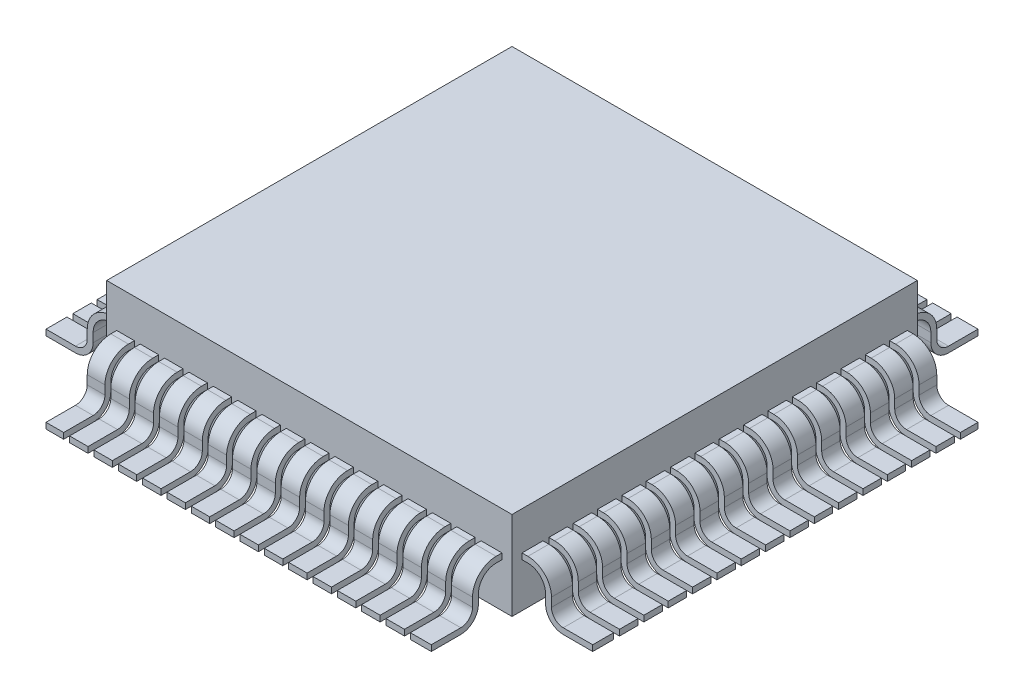
from build123d import *

# Parameters (mm, degrees)
SKETCH_1_W                = 6.88
SKETCH_1_H                = 6.88
EXTRUDE_1_DEPTH           = 1.5
EXTRUDE_1_2_DEPTH         = 6.88
SKETCH_3_W                = 1.2
SKETCH_3_H                = 0.17
CUT_EXTRUDE_1_DEPTH       = 1.5
SKETCH_4_W                = 1.2
SKETCH_4_H                = 0.1
CUT_EXTRUDE_2_DEPTH       = 1.5
PATTERN_LINEAR_1_COUNT    = 15
PATTERN_LINEAR_1_PITCH    = 0.4132
SKETCH_5_R                = 0.131532071
CUT_EXTRUDE_3_DEPTH       = 1
MIRROR_2_COPY_1_SKETCH_W  = 1.2
MIRROR_2_COPY_1_SKETCH_H  = 0.1
MIRROR_2_COPY_1_DEPTH     = 1.5
MIRROR_2_COPY_2_SKETCH_W  = 1.2
MIRROR_2_COPY_2_SKETCH_H  = 0.1
MIRROR_2_COPY_2_DEPTH     = 1.5
MIRROR_2_COPY_3_SKETCH_W  = 1.2
MIRROR_2_COPY_3_SKETCH_H  = 0.1
MIRROR_2_COPY_3_DEPTH     = 1.5
MIRROR_2_COPY_4_SKETCH_W  = 1.2
MIRROR_2_COPY_4_SKETCH_H  = 0.1
MIRROR_2_COPY_4_DEPTH     = 1.5
MIRROR_2_COPY_5_SKETCH_W  = 1.2
MIRROR_2_COPY_5_SKETCH_H  = 0.1
MIRROR_2_COPY_5_DEPTH     = 1.5
MIRROR_2_COPY_6_SKETCH_W  = 1.2
MIRROR_2_COPY_6_SKETCH_H  = 0.1
MIRROR_2_COPY_6_DEPTH     = 1.5
MIRROR_2_COPY_7_SKETCH_W  = 1.2
MIRROR_2_COPY_7_SKETCH_H  = 0.1
MIRROR_2_COPY_7_DEPTH     = 1.5
MIRROR_2_COPY_8_SKETCH_W  = 1.2
MIRROR_2_COPY_8_SKETCH_H  = 0.1
MIRROR_2_COPY_8_DEPTH     = 1.5
MIRROR_2_COPY_9_SKETCH_W  = 1.2
MIRROR_2_COPY_9_SKETCH_H  = 0.1
MIRROR_2_COPY_9_DEPTH     = 1.5
MIRROR_2_COPY_10_SKETCH_W = 1.2
MIRROR_2_COPY_10_SKETCH_H = 0.1
MIRROR_2_COPY_10_DEPTH    = 1.5
MIRROR_2_COPY_11_SKETCH_W = 1.2
MIRROR_2_COPY_11_SKETCH_H = 0.1
MIRROR_2_COPY_11_DEPTH    = 1.5
MIRROR_2_COPY_12_SKETCH_W = 1.2
MIRROR_2_COPY_12_SKETCH_H = 0.1
MIRROR_2_COPY_12_DEPTH    = 1.5
MIRROR_2_COPY_13_SKETCH_W = 1.2
MIRROR_2_COPY_13_SKETCH_H = 0.1
MIRROR_2_COPY_13_DEPTH    = 1.5
MIRROR_2_COPY_14_SKETCH_W = 1.2
MIRROR_2_COPY_14_SKETCH_H = 0.1
MIRROR_2_COPY_14_DEPTH    = 1.5
EXTRUDE_2_DEPTH           = 6.88
CUT_EXTRUDE_4_REACH       = 8.731
SKETCH_7_W                = 0.17
SKETCH_7_H                = 1.2
CUT_EXTRUDE_5_REACH       = 8.731
SKETCH_8_W                = 0.1
SKETCH_8_H                = 1.2
PATTERN_LINEAR_2_COUNT    = 15
PATTERN_LINEAR_2_PITCH    = 0.4132
MIRROR_3_COPY_1_REACH     = 8.731
MIRROR_3_COPY_1_SKETCH_W  = 0.1
MIRROR_3_COPY_1_SKETCH_H  = 1.2
MIRROR_3_COPY_2_REACH     = 8.731
MIRROR_3_COPY_2_SKETCH_W  = 0.1
MIRROR_3_COPY_2_SKETCH_H  = 1.2
MIRROR_3_COPY_3_REACH     = 8.731
MIRROR_3_COPY_3_SKETCH_W  = 0.1
MIRROR_3_COPY_3_SKETCH_H  = 1.2
MIRROR_3_COPY_4_REACH     = 8.731
MIRROR_3_COPY_4_SKETCH_W  = 0.1
MIRROR_3_COPY_4_SKETCH_H  = 1.2
MIRROR_3_COPY_5_REACH     = 8.731
MIRROR_3_COPY_5_SKETCH_W  = 0.1
MIRROR_3_COPY_5_SKETCH_H  = 1.2
MIRROR_3_COPY_6_REACH     = 8.731
MIRROR_3_COPY_6_SKETCH_W  = 0.1
MIRROR_3_COPY_6_SKETCH_H  = 1.2
MIRROR_3_COPY_7_REACH     = 8.731
MIRROR_3_COPY_7_SKETCH_W  = 0.1
MIRROR_3_COPY_7_SKETCH_H  = 1.2
MIRROR_3_COPY_8_REACH     = 8.731
MIRROR_3_COPY_8_SKETCH_W  = 0.1
MIRROR_3_COPY_8_SKETCH_H  = 1.2
MIRROR_3_COPY_9_REACH     = 8.731
MIRROR_3_COPY_9_SKETCH_W  = 0.1
MIRROR_3_COPY_9_SKETCH_H  = 1.2
MIRROR_3_COPY_10_REACH    = 8.731
MIRROR_3_COPY_10_SKETCH_W = 0.1
MIRROR_3_COPY_10_SKETCH_H = 1.2
MIRROR_3_COPY_11_REACH    = 8.731
MIRROR_3_COPY_11_SKETCH_W = 0.1
MIRROR_3_COPY_11_SKETCH_H = 1.2
MIRROR_3_COPY_12_REACH    = 8.731
MIRROR_3_COPY_12_SKETCH_W = 0.1
MIRROR_3_COPY_12_SKETCH_H = 1.2
MIRROR_3_COPY_13_REACH    = 8.731
MIRROR_3_COPY_13_SKETCH_W = 0.1
MIRROR_3_COPY_13_SKETCH_H = 1.2
MIRROR_3_COPY_14_REACH    = 8.731
MIRROR_3_COPY_14_SKETCH_W = 0.1
MIRROR_3_COPY_14_SKETCH_H = 1.2


with BuildPart() as part:
    # 草图1 → Extrude 1 (new body)
    with BuildSketch(Plane(origin=(0, 0, 0), x_dir=(1, 0, 0), z_dir=(0, 1, 0))):
        Rectangle(SKETCH_1_W, SKETCH_1_H)
    extrude(amount=EXTRUDE_1_DEPTH)

    # 草图2 → Extrude 1 2 (add)
    with BuildSketch(Plane.XY.offset(3.44)):
        with BuildLine():
            Line((-3.44, 0.75), (-3.54, 0.75))
            ThreePointArc((-3.54, 0.75), (-3.752132034, 0.662132034), (-3.84, 0.45))
            Line((-3.84, 0.45), (-3.84, 0.3))
            ThreePointArc((-3.84, 0.3), (-3.927867966, 0.087867966), (-4.14, 0))
            Line((-4.14, 0), (-4.64, 0))
            Line((-4.64, 0), (-4.64, 0.1))
            Line((-4.64, 0.1), (-4.14, 0.1))
            ThreePointArc((-4.14, 0.1), (-3.998578644, 0.158578644), (-3.94, 0.3))
            Line((-3.94, 0.3), (-3.94, 0.45))
            ThreePointArc((-3.94, 0.45), (-3.822842712, 0.732842712), (-3.54, 0.85))
            Line((-3.54, 0.85), (-3.44, 0.85))
            Line((-3.44, 0.85), (-3.44, 0.75))
        make_face()
    extrude_1_2 = extrude(amount=-EXTRUDE_1_2_DEPTH)

    # 草图3 → 切除-拉伸1 (cut)
    with BuildSketch(Plane(origin=(0, 1.5, 0), x_dir=(1, 0, 0), z_dir=(0, 1, 0))):
        with Locations((-4.04, 3.355)):
            Rectangle(SKETCH_3_W, SKETCH_3_H)
        with Locations((-4.04, -3.355)):
            Rectangle(SKETCH_3_W, SKETCH_3_H)
    cut_extrude_1 = extrude(amount=-CUT_EXTRUDE_1_DEPTH, mode=Mode.SUBTRACT)

    # 草图4 → 切除-拉伸2 (cut)
    with BuildSketch(Plane(origin=(0, 1.5, 0), x_dir=(1, 0, 0), z_dir=(0, 1, 0))):
        with Locations((-4.04, 2.92)):
            Rectangle(SKETCH_4_W, SKETCH_4_H)
    cut_extrude_2 = extrude(amount=-CUT_EXTRUDE_2_DEPTH, mode=Mode.SUBTRACT)

    # 阵列(线性)1: 切除-拉伸2 ×15
    with Locations(*[(0, 0, i * PATTERN_LINEAR_1_PITCH) for i in range(1, PATTERN_LINEAR_1_COUNT)]):
        add(cut_extrude_2, mode=Mode.SUBTRACT)

    # 草图5 → 切除-拉伸3 (cut)
    with BuildSketch(Plane.XZ):
        with Locations(Location((0, 0, 0), (0, 0, 270))):
            Circle(SKETCH_5_R)
    extrude(amount=-CUT_EXTRUDE_3_DEPTH, mode=Mode.SUBTRACT)

    # 镜向2: Extrude 1 2, 切除-拉伸1, 切除-拉伸2 across plane
    add(extrude_1_2.mirror(Plane(origin=(0, 0, 0), x_dir=(0, 0, 1), z_dir=(1, 0, 0))))
    add(cut_extrude_1.mirror(Plane(origin=(0, 0, 0), x_dir=(0, 0, 1), z_dir=(1, 0, 0))), mode=Mode.SUBTRACT)
    add(cut_extrude_2.mirror(Plane(origin=(0, 0, 0), x_dir=(0, 0, 1), z_dir=(1, 0, 0))), mode=Mode.SUBTRACT)

    # 镜向2 copy 1 sketch → 镜向2 copy 1 (cut)
    with BuildSketch(Plane(origin=(0, 1.5, 0.4132), x_dir=(-1, 0, 0), z_dir=(0, 1, 0))):
        with Locations((-4.04, -2.92)):
            Rectangle(MIRROR_2_COPY_1_SKETCH_W, MIRROR_2_COPY_1_SKETCH_H)
    extrude(amount=-MIRROR_2_COPY_1_DEPTH, mode=Mode.SUBTRACT)

    # 镜向2 copy 2 sketch → 镜向2 copy 2 (cut)
    with BuildSketch(Plane(origin=(0, 1.5, 0.8264), x_dir=(-1, 0, 0), z_dir=(0, 1, 0))):
        with Locations((-4.04, -2.92)):
            Rectangle(MIRROR_2_COPY_2_SKETCH_W, MIRROR_2_COPY_2_SKETCH_H)
    extrude(amount=-MIRROR_2_COPY_2_DEPTH, mode=Mode.SUBTRACT)

    # 镜向2 copy 3 sketch → 镜向2 copy 3 (cut)
    with BuildSketch(Plane(origin=(0, 1.5, 1.2396), x_dir=(-1, 0, 0), z_dir=(0, 1, 0))):
        with Locations((-4.04, -2.92)):
            Rectangle(MIRROR_2_COPY_3_SKETCH_W, MIRROR_2_COPY_3_SKETCH_H)
    extrude(amount=-MIRROR_2_COPY_3_DEPTH, mode=Mode.SUBTRACT)

    # 镜向2 copy 4 sketch → 镜向2 copy 4 (cut)
    with BuildSketch(Plane(origin=(0, 1.5, 1.6528), x_dir=(-1, 0, 0), z_dir=(0, 1, 0))):
        with Locations((-4.04, -2.92)):
            Rectangle(MIRROR_2_COPY_4_SKETCH_W, MIRROR_2_COPY_4_SKETCH_H)
    extrude(amount=-MIRROR_2_COPY_4_DEPTH, mode=Mode.SUBTRACT)

    # 镜向2 copy 5 sketch → 镜向2 copy 5 (cut)
    with BuildSketch(Plane(origin=(0, 1.5, 2.066), x_dir=(-1, 0, 0), z_dir=(0, 1, 0))):
        with Locations((-4.04, -2.92)):
            Rectangle(MIRROR_2_COPY_5_SKETCH_W, MIRROR_2_COPY_5_SKETCH_H)
    extrude(amount=-MIRROR_2_COPY_5_DEPTH, mode=Mode.SUBTRACT)

    # 镜向2 copy 6 sketch → 镜向2 copy 6 (cut)
    with BuildSketch(Plane(origin=(0, 1.5, 2.4792), x_dir=(-1, 0, 0), z_dir=(0, 1, 0))):
        with Locations((-4.04, -2.92)):
            Rectangle(MIRROR_2_COPY_6_SKETCH_W, MIRROR_2_COPY_6_SKETCH_H)
    extrude(amount=-MIRROR_2_COPY_6_DEPTH, mode=Mode.SUBTRACT)

    # 镜向2 copy 7 sketch → 镜向2 copy 7 (cut)
    with BuildSketch(Plane(origin=(0, 1.5, 2.8924), x_dir=(-1, 0, 0), z_dir=(0, 1, 0))):
        with Locations((-4.04, -2.92)):
            Rectangle(MIRROR_2_COPY_7_SKETCH_W, MIRROR_2_COPY_7_SKETCH_H)
    extrude(amount=-MIRROR_2_COPY_7_DEPTH, mode=Mode.SUBTRACT)

    # 镜向2 copy 8 sketch → 镜向2 copy 8 (cut)
    with BuildSketch(Plane(origin=(0, 1.5, 3.3056), x_dir=(-1, 0, 0), z_dir=(0, 1, 0))):
        with Locations((-4.04, -2.92)):
            Rectangle(MIRROR_2_COPY_8_SKETCH_W, MIRROR_2_COPY_8_SKETCH_H)
    extrude(amount=-MIRROR_2_COPY_8_DEPTH, mode=Mode.SUBTRACT)

    # 镜向2 copy 9 sketch → 镜向2 copy 9 (cut)
    with BuildSketch(Plane(origin=(0, 1.5, 3.7188), x_dir=(-1, 0, 0), z_dir=(0, 1, 0))):
        with Locations((-4.04, -2.92)):
            Rectangle(MIRROR_2_COPY_9_SKETCH_W, MIRROR_2_COPY_9_SKETCH_H)
    extrude(amount=-MIRROR_2_COPY_9_DEPTH, mode=Mode.SUBTRACT)

    # 镜向2 copy 10 sketch → 镜向2 copy 10 (cut)
    with BuildSketch(Plane(origin=(0, 1.5, 4.132), x_dir=(-1, 0, 0), z_dir=(0, 1, 0))):
        with Locations((-4.04, -2.92)):
            Rectangle(MIRROR_2_COPY_10_SKETCH_W, MIRROR_2_COPY_10_SKETCH_H)
    extrude(amount=-MIRROR_2_COPY_10_DEPTH, mode=Mode.SUBTRACT)

    # 镜向2 copy 11 sketch → 镜向2 copy 11 (cut)
    with BuildSketch(Plane(origin=(0, 1.5, 4.5452), x_dir=(-1, 0, 0), z_dir=(0, 1, 0))):
        with Locations((-4.04, -2.92)):
            Rectangle(MIRROR_2_COPY_11_SKETCH_W, MIRROR_2_COPY_11_SKETCH_H)
    extrude(amount=-MIRROR_2_COPY_11_DEPTH, mode=Mode.SUBTRACT)

    # 镜向2 copy 12 sketch → 镜向2 copy 12 (cut)
    with BuildSketch(Plane(origin=(0, 1.5, 4.9584), x_dir=(-1, 0, 0), z_dir=(0, 1, 0))):
        with Locations((-4.04, -2.92)):
            Rectangle(MIRROR_2_COPY_12_SKETCH_W, MIRROR_2_COPY_12_SKETCH_H)
    extrude(amount=-MIRROR_2_COPY_12_DEPTH, mode=Mode.SUBTRACT)

    # 镜向2 copy 13 sketch → 镜向2 copy 13 (cut)
    with BuildSketch(Plane(origin=(0, 1.5, 5.3716), x_dir=(-1, 0, 0), z_dir=(0, 1, 0))):
        with Locations((-4.04, -2.92)):
            Rectangle(MIRROR_2_COPY_13_SKETCH_W, MIRROR_2_COPY_13_SKETCH_H)
    extrude(amount=-MIRROR_2_COPY_13_DEPTH, mode=Mode.SUBTRACT)

    # 镜向2 copy 14 sketch → 镜向2 copy 14 (cut)
    with BuildSketch(Plane(origin=(0, 1.5, 5.7848), x_dir=(-1, 0, 0), z_dir=(0, 1, 0))):
        with Locations((-4.04, -2.92)):
            Rectangle(MIRROR_2_COPY_14_SKETCH_W, MIRROR_2_COPY_14_SKETCH_H)
    extrude(amount=-MIRROR_2_COPY_14_DEPTH, mode=Mode.SUBTRACT)

    # 草图6 → 拉伸-薄壁2 (add)
    with BuildSketch(Plane.ZY.offset(3.44)):
        with BuildLine():
            Line((-3.44, 0.75), (-3.54, 0.75))
            ThreePointArc((-3.54, 0.75), (-3.752132034, 0.662132034), (-3.84, 0.45))
            Line((-3.84, 0.45), (-3.84, 0.3))
            ThreePointArc((-3.84, 0.3), (-3.927867966, 0.087867966), (-4.14, 0))
            Line((-4.14, 0), (-4.64, 0))
            Line((-4.64, 0), (-4.64, 0.1))
            Line((-4.64, 0.1), (-4.14, 0.1))
            ThreePointArc((-4.14, 0.1), (-3.998578644, 0.158578644), (-3.94, 0.3))
            Line((-3.94, 0.3), (-3.94, 0.45))
            ThreePointArc((-3.94, 0.45), (-3.822842712, 0.732842712), (-3.54, 0.85))
            Line((-3.54, 0.85), (-3.44, 0.85))
            Line((-3.44, 0.85), (-3.44, 0.75))
        make_face()
    extrude_2 = extrude(amount=-EXTRUDE_2_DEPTH)

    # 草图7 → 切除-拉伸4 (cut, up to next)
    with BuildSketch(Plane(origin=(0, 1.5, 0), x_dir=(1, 0, 0), z_dir=(0, 1, 0)), mode=Mode.PRIVATE) as cut_extrude_4_sk1:
        with Locations((-3.355, 4.04)):
            Rectangle(SKETCH_7_W, SKETCH_7_H)
    cut_extrude_4_tool1 = extrude(cut_extrude_4_sk1.sketch, amount=-CUT_EXTRUDE_4_REACH, mode=Mode.PRIVATE) & part.part
    # 草图7 → 切除-拉伸4 (cut, up to next)
    with BuildSketch(Plane(origin=(0, 1.5, 0), x_dir=(1, 0, 0), z_dir=(0, 1, 0)), mode=Mode.PRIVATE) as cut_extrude_4_sk2:
        with Locations((3.355, 4.04)):
            Rectangle(SKETCH_7_W, SKETCH_7_H)
    cut_extrude_4_tool2 = extrude(cut_extrude_4_sk2.sketch, amount=-CUT_EXTRUDE_4_REACH, mode=Mode.PRIVATE) & part.part
    cut_extrude_4_1 = cut_extrude_4_tool1.solids().sort_by_distance((-3.355, 1.5, -4.04))[0]
    add(cut_extrude_4_1, mode=Mode.SUBTRACT)
    cut_extrude_4_2 = cut_extrude_4_tool2.solids().sort_by_distance((3.355, 1.5, -4.04))[0]
    add(cut_extrude_4_2, mode=Mode.SUBTRACT)
    cut_extrude_4 = cut_extrude_4_1 + cut_extrude_4_2  # 切除-拉伸4 as one shape, for the pattern or mirror that repeats it

    # 草图8 → 切除-拉伸5 (cut, up to next)
    with BuildSketch(Plane(origin=(0, 1.5, 0), x_dir=(1, 0, 0), z_dir=(0, 1, 0)), mode=Mode.PRIVATE) as cut_extrude_5_sk1:
        with Locations((-2.92, 4.04)):
            Rectangle(SKETCH_8_W, SKETCH_8_H)
    cut_extrude_5_tool1 = extrude(cut_extrude_5_sk1.sketch, amount=-CUT_EXTRUDE_5_REACH, mode=Mode.PRIVATE) & part.part
    cut_extrude_5 = cut_extrude_5_tool1.solids().sort_by_distance((-2.92, 1.5, -4.04))[0]
    add(cut_extrude_5, mode=Mode.SUBTRACT)

    # 阵列(线性)2: 切除-拉伸5 ×15
    with Locations(*[(i * PATTERN_LINEAR_2_PITCH, 0, 0) for i in range(1, PATTERN_LINEAR_2_COUNT)]):
        add(cut_extrude_5, mode=Mode.SUBTRACT)

    # 镜向3: 拉伸-薄壁2, 切除-拉伸4, 切除-拉伸5 across plane
    add(extrude_2.mirror(Plane.XY))
    add(cut_extrude_4.mirror(Plane.XY), mode=Mode.SUBTRACT)
    add(cut_extrude_5.mirror(Plane.XY), mode=Mode.SUBTRACT)

    # 镜向3 copy 1 sketch → 镜向3 copy 1 (cut, up to next)
    with BuildSketch(Plane(origin=(0.4132, 1.5, 0), x_dir=(1, 0, 0), z_dir=(0, 1, 0)), mode=Mode.PRIVATE) as mirror_3_copy_1_sk1:
        with Locations((-2.92, -4.04)):
            Rectangle(MIRROR_3_COPY_1_SKETCH_W, MIRROR_3_COPY_1_SKETCH_H)
    mirror_3_copy_1_tool1 = extrude(mirror_3_copy_1_sk1.sketch, amount=-MIRROR_3_COPY_1_REACH, mode=Mode.PRIVATE) & part.part
    add(mirror_3_copy_1_tool1.solids().sort_by_distance((-2.5068, 1.5, 4.04))[0], mode=Mode.SUBTRACT)

    # 镜向3 copy 2 sketch → 镜向3 copy 2 (cut, up to next)
    with BuildSketch(Plane(origin=(0.8264, 1.5, 0), x_dir=(1, 0, 0), z_dir=(0, 1, 0)), mode=Mode.PRIVATE) as mirror_3_copy_2_sk1:
        with Locations((-2.92, -4.04)):
            Rectangle(MIRROR_3_COPY_2_SKETCH_W, MIRROR_3_COPY_2_SKETCH_H)
    mirror_3_copy_2_tool1 = extrude(mirror_3_copy_2_sk1.sketch, amount=-MIRROR_3_COPY_2_REACH, mode=Mode.PRIVATE) & part.part
    add(mirror_3_copy_2_tool1.solids().sort_by_distance((-2.0936, 1.5, 4.04))[0], mode=Mode.SUBTRACT)

    # 镜向3 copy 3 sketch → 镜向3 copy 3 (cut, up to next)
    with BuildSketch(Plane(origin=(1.2396, 1.5, 0), x_dir=(1, 0, 0), z_dir=(0, 1, 0)), mode=Mode.PRIVATE) as mirror_3_copy_3_sk1:
        with Locations((-2.92, -4.04)):
            Rectangle(MIRROR_3_COPY_3_SKETCH_W, MIRROR_3_COPY_3_SKETCH_H)
    mirror_3_copy_3_tool1 = extrude(mirror_3_copy_3_sk1.sketch, amount=-MIRROR_3_COPY_3_REACH, mode=Mode.PRIVATE) & part.part
    add(mirror_3_copy_3_tool1.solids().sort_by_distance((-1.6804, 1.5, 4.04))[0], mode=Mode.SUBTRACT)

    # 镜向3 copy 4 sketch → 镜向3 copy 4 (cut, up to next)
    with BuildSketch(Plane(origin=(1.6528, 1.5, 0), x_dir=(1, 0, 0), z_dir=(0, 1, 0)), mode=Mode.PRIVATE) as mirror_3_copy_4_sk1:
        with Locations((-2.92, -4.04)):
            Rectangle(MIRROR_3_COPY_4_SKETCH_W, MIRROR_3_COPY_4_SKETCH_H)
    mirror_3_copy_4_tool1 = extrude(mirror_3_copy_4_sk1.sketch, amount=-MIRROR_3_COPY_4_REACH, mode=Mode.PRIVATE) & part.part
    add(mirror_3_copy_4_tool1.solids().sort_by_distance((-1.2672, 1.5, 4.04))[0], mode=Mode.SUBTRACT)

    # 镜向3 copy 5 sketch → 镜向3 copy 5 (cut, up to next)
    with BuildSketch(Plane(origin=(2.066, 1.5, 0), x_dir=(1, 0, 0), z_dir=(0, 1, 0)), mode=Mode.PRIVATE) as mirror_3_copy_5_sk1:
        with Locations((-2.92, -4.04)):
            Rectangle(MIRROR_3_COPY_5_SKETCH_W, MIRROR_3_COPY_5_SKETCH_H)
    mirror_3_copy_5_tool1 = extrude(mirror_3_copy_5_sk1.sketch, amount=-MIRROR_3_COPY_5_REACH, mode=Mode.PRIVATE) & part.part
    add(mirror_3_copy_5_tool1.solids().sort_by_distance((-0.854, 1.5, 4.04))[0], mode=Mode.SUBTRACT)

    # 镜向3 copy 6 sketch → 镜向3 copy 6 (cut, up to next)
    with BuildSketch(Plane(origin=(2.4792, 1.5, 0), x_dir=(1, 0, 0), z_dir=(0, 1, 0)), mode=Mode.PRIVATE) as mirror_3_copy_6_sk1:
        with Locations((-2.92, -4.04)):
            Rectangle(MIRROR_3_COPY_6_SKETCH_W, MIRROR_3_COPY_6_SKETCH_H)
    mirror_3_copy_6_tool1 = extrude(mirror_3_copy_6_sk1.sketch, amount=-MIRROR_3_COPY_6_REACH, mode=Mode.PRIVATE) & part.part
    add(mirror_3_copy_6_tool1.solids().sort_by_distance((-0.4408, 1.5, 4.04))[0], mode=Mode.SUBTRACT)

    # 镜向3 copy 7 sketch → 镜向3 copy 7 (cut, up to next)
    with BuildSketch(Plane(origin=(2.8924, 1.5, 0), x_dir=(1, 0, 0), z_dir=(0, 1, 0)), mode=Mode.PRIVATE) as mirror_3_copy_7_sk1:
        with Locations((-2.92, -4.04)):
            Rectangle(MIRROR_3_COPY_7_SKETCH_W, MIRROR_3_COPY_7_SKETCH_H)
    mirror_3_copy_7_tool1 = extrude(mirror_3_copy_7_sk1.sketch, amount=-MIRROR_3_COPY_7_REACH, mode=Mode.PRIVATE) & part.part
    add(mirror_3_copy_7_tool1.solids().sort_by_distance((-0.0276, 1.5, 4.04))[0], mode=Mode.SUBTRACT)

    # 镜向3 copy 8 sketch → 镜向3 copy 8 (cut, up to next)
    with BuildSketch(Plane(origin=(3.3056, 1.5, 0), x_dir=(1, 0, 0), z_dir=(0, 1, 0)), mode=Mode.PRIVATE) as mirror_3_copy_8_sk1:
        with Locations((-2.92, -4.04)):
            Rectangle(MIRROR_3_COPY_8_SKETCH_W, MIRROR_3_COPY_8_SKETCH_H)
    mirror_3_copy_8_tool1 = extrude(mirror_3_copy_8_sk1.sketch, amount=-MIRROR_3_COPY_8_REACH, mode=Mode.PRIVATE) & part.part
    add(mirror_3_copy_8_tool1.solids().sort_by_distance((0.3856, 1.5, 4.04))[0], mode=Mode.SUBTRACT)

    # 镜向3 copy 9 sketch → 镜向3 copy 9 (cut, up to next)
    with BuildSketch(Plane(origin=(3.7188, 1.5, 0), x_dir=(1, 0, 0), z_dir=(0, 1, 0)), mode=Mode.PRIVATE) as mirror_3_copy_9_sk1:
        with Locations((-2.92, -4.04)):
            Rectangle(MIRROR_3_COPY_9_SKETCH_W, MIRROR_3_COPY_9_SKETCH_H)
    mirror_3_copy_9_tool1 = extrude(mirror_3_copy_9_sk1.sketch, amount=-MIRROR_3_COPY_9_REACH, mode=Mode.PRIVATE) & part.part
    add(mirror_3_copy_9_tool1.solids().sort_by_distance((0.7988, 1.5, 4.04))[0], mode=Mode.SUBTRACT)

    # 镜向3 copy 10 sketch → 镜向3 copy 10 (cut, up to next)
    with BuildSketch(Plane(origin=(4.132, 1.5, 0), x_dir=(1, 0, 0), z_dir=(0, 1, 0)), mode=Mode.PRIVATE) as mirror_3_copy_10_sk1:
        with Locations((-2.92, -4.04)):
            Rectangle(MIRROR_3_COPY_10_SKETCH_W, MIRROR_3_COPY_10_SKETCH_H)
    mirror_3_copy_10_tool1 = extrude(mirror_3_copy_10_sk1.sketch, amount=-MIRROR_3_COPY_10_REACH, mode=Mode.PRIVATE) & part.part
    add(mirror_3_copy_10_tool1.solids().sort_by_distance((1.212, 1.5, 4.04))[0], mode=Mode.SUBTRACT)

    # 镜向3 copy 11 sketch → 镜向3 copy 11 (cut, up to next)
    with BuildSketch(Plane(origin=(4.5452, 1.5, 0), x_dir=(1, 0, 0), z_dir=(0, 1, 0)), mode=Mode.PRIVATE) as mirror_3_copy_11_sk1:
        with Locations((-2.92, -4.04)):
            Rectangle(MIRROR_3_COPY_11_SKETCH_W, MIRROR_3_COPY_11_SKETCH_H)
    mirror_3_copy_11_tool1 = extrude(mirror_3_copy_11_sk1.sketch, amount=-MIRROR_3_COPY_11_REACH, mode=Mode.PRIVATE) & part.part
    add(mirror_3_copy_11_tool1.solids().sort_by_distance((1.6252, 1.5, 4.04))[0], mode=Mode.SUBTRACT)

    # 镜向3 copy 12 sketch → 镜向3 copy 12 (cut, up to next)
    with BuildSketch(Plane(origin=(4.9584, 1.5, 0), x_dir=(1, 0, 0), z_dir=(0, 1, 0)), mode=Mode.PRIVATE) as mirror_3_copy_12_sk1:
        with Locations((-2.92, -4.04)):
            Rectangle(MIRROR_3_COPY_12_SKETCH_W, MIRROR_3_COPY_12_SKETCH_H)
    mirror_3_copy_12_tool1 = extrude(mirror_3_copy_12_sk1.sketch, amount=-MIRROR_3_COPY_12_REACH, mode=Mode.PRIVATE) & part.part
    add(mirror_3_copy_12_tool1.solids().sort_by_distance((2.0384, 1.5, 4.04))[0], mode=Mode.SUBTRACT)

    # 镜向3 copy 13 sketch → 镜向3 copy 13 (cut, up to next)
    with BuildSketch(Plane(origin=(5.3716, 1.5, 0), x_dir=(1, 0, 0), z_dir=(0, 1, 0)), mode=Mode.PRIVATE) as mirror_3_copy_13_sk1:
        with Locations((-2.92, -4.04)):
            Rectangle(MIRROR_3_COPY_13_SKETCH_W, MIRROR_3_COPY_13_SKETCH_H)
    mirror_3_copy_13_tool1 = extrude(mirror_3_copy_13_sk1.sketch, amount=-MIRROR_3_COPY_13_REACH, mode=Mode.PRIVATE) & part.part
    add(mirror_3_copy_13_tool1.solids().sort_by_distance((2.4516, 1.5, 4.04))[0], mode=Mode.SUBTRACT)

    # 镜向3 copy 14 sketch → 镜向3 copy 14 (cut, up to next)
    with BuildSketch(Plane(origin=(5.7848, 1.5, 0), x_dir=(1, 0, 0), z_dir=(0, 1, 0)), mode=Mode.PRIVATE) as mirror_3_copy_14_sk1:
        with Locations((-2.92, -4.04)):
            Rectangle(MIRROR_3_COPY_14_SKETCH_W, MIRROR_3_COPY_14_SKETCH_H)
    mirror_3_copy_14_tool1 = extrude(mirror_3_copy_14_sk1.sketch, amount=-MIRROR_3_COPY_14_REACH, mode=Mode.PRIVATE) & part.part
    add(mirror_3_copy_14_tool1.solids().sort_by_distance((2.8648, 1.5, 4.04))[0], mode=Mode.SUBTRACT)


solid = part.part
